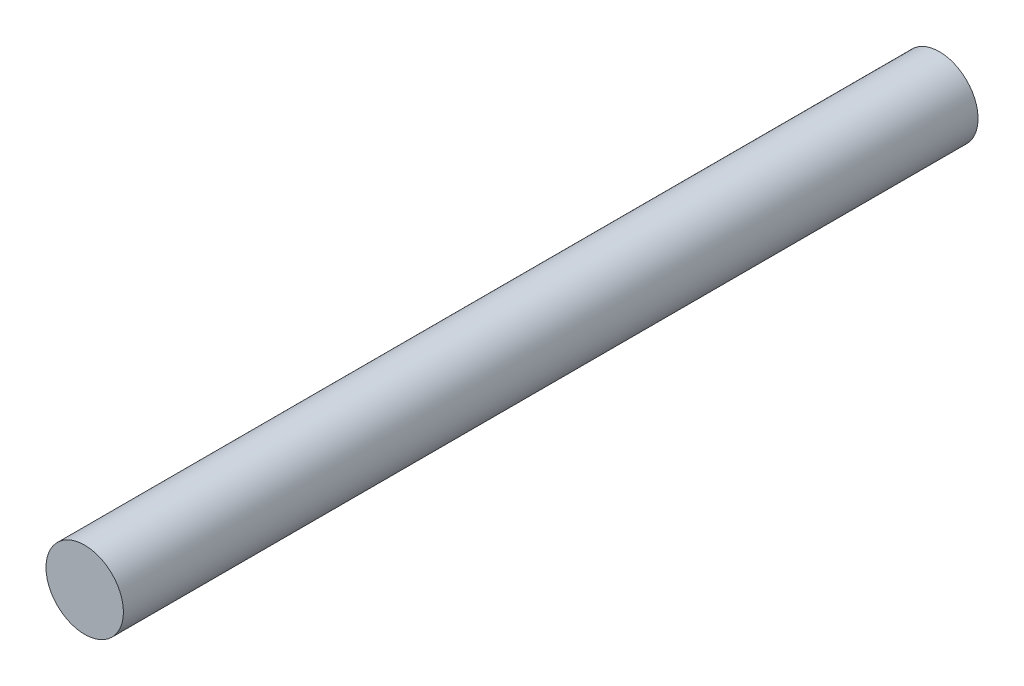
from build123d import *

# Parameters (mm, degrees)
SKETCH_1_R      = 5.25
EXTRUDE_1_DEPTH = 116


with BuildPart() as part:
    # Эскиз1 → Вытянуть1 (new body)
    with BuildSketch(Plane.XY):
        Circle(SKETCH_1_R)
    extrude(amount=EXTRUDE_1_DEPTH)


solid = part.part
